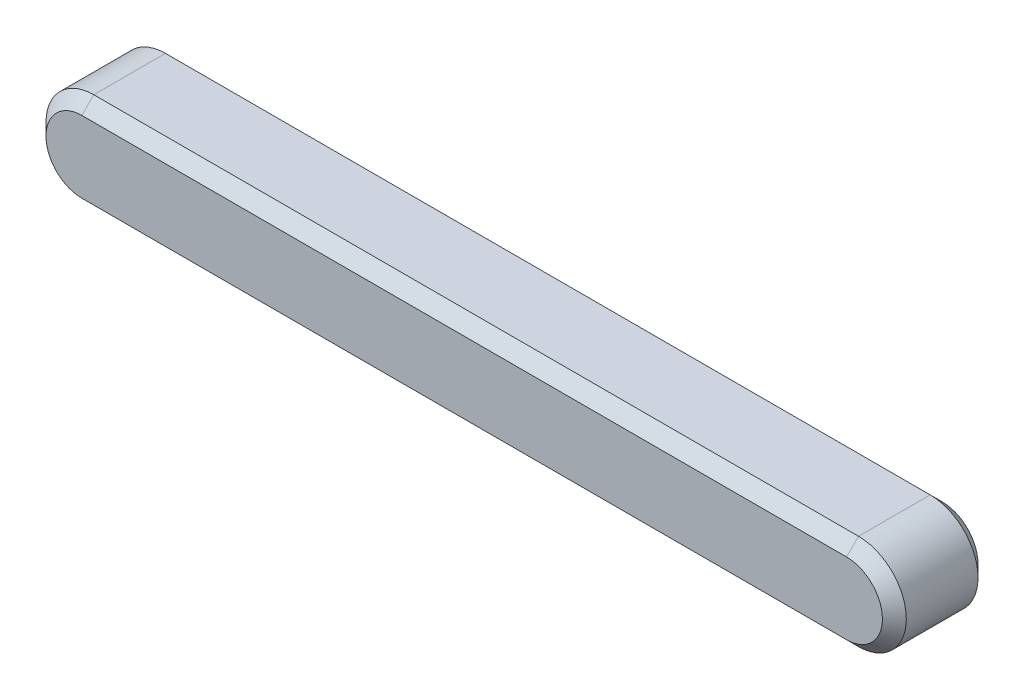
from build123d import *

# Parameters (mm, degrees)
EXTRUDE1_DEPTH = 2
CHAMFER1_SIZE  = 0.25


with BuildPart() as part:
    # body → Extrude1 (new body)
    with BuildSketch(Plane.XY):
        with BuildLine():
            Line((0, 0), (16, 0))
            ThreePointArc((16, 0), (17, 1), (16, 2))
            Line((16, 2), (0, 2))
            ThreePointArc((0, 2), (-1, 1), (0, 0))
        make_face()
    extrude(amount=EXTRUDE1_DEPTH)

    # Chamfer1
    chamfer1_edges = [part.edges().sort_by_distance(p)[0] for p in [
        (-1, 1, 0),
        (8, 0, 0),
        (17, 1, 0),
        (8, 2, 0),
        (-1, 1, 2),
        (8, 0, 2),
        (17, 1, 2),
        (8, 2, 2),
    ]]
    chamfer(chamfer1_edges, length=CHAMFER1_SIZE)


solid = part.part
